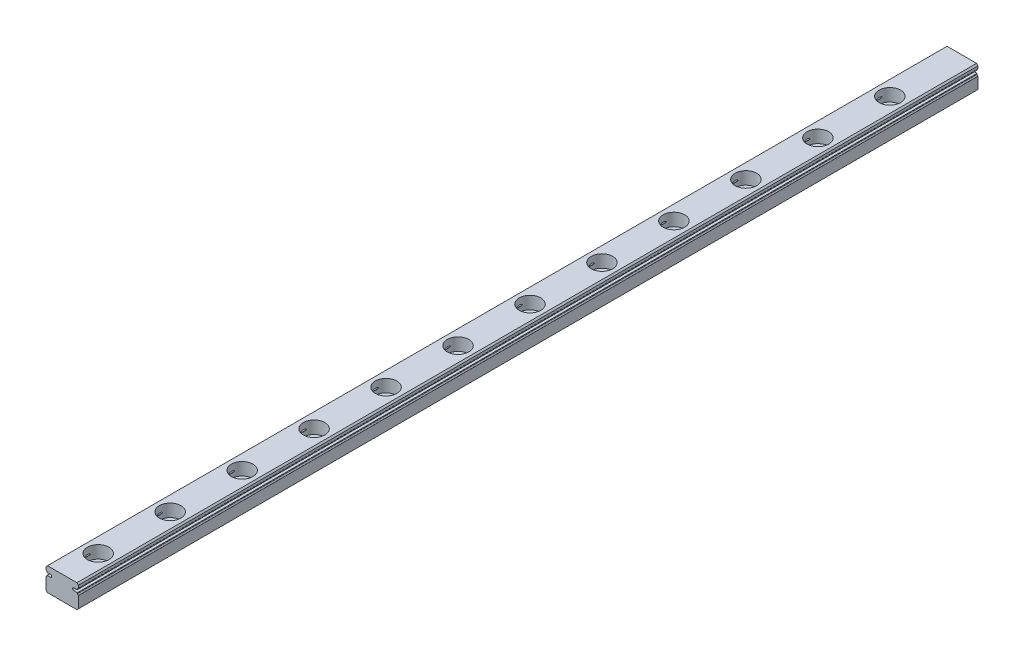
from build123d import *
from OCP.BRepFilletAPI import BRepFilletAPI_MakeChamfer

# Parameters (mm, degrees)
CROQUIS1_W                                           = 9
CROQUIS1_H                                           = 500
SALIENTE_EXTRUIR1_DEPTH                              = 6.5
CORTAR_EXTRUIR1_DEPTH                                = 501.031176557
CORTAR_EXTRUIR2_DEPTH                                = 501.031176557
CORTAR_EXTRUIR3_DEPTH                                = 501.031176557
CORTAR_EXTRUIR4_DEPTH                                = 501.031176557
CORTAR_EXTRUIR5_DEPTH                                = 501.031176557
CORTAR_EXTRUIR6_DEPTH                                = 501.031176557
CORTAR_EXTRUIR7_DEPTH                                = 501.031176557
REFRENTADO_PARA_TORNILLO_CON_CABEZA_HEXA_D           = 3.5
REFRENTADO_PARA_TORNILLO_CON_CABEZA_HEXA_CBORE_D     = 6
REFRENTADO_PARA_TORNILLO_CON_CABEZA_HEXA_CBORE_DEPTH = 3.5
CHAFL_N1_SIZE                                        = 0.4
CHAFL_N2_SIZE                                        = 0.01099309
CHAFL_N2_SIZE2                                       = 0.011992462
CHAFL_N3_SIZE                                        = 0.127904947
CHAFL_N3_SIZE_2                                      = 0.150967803
CROQUIS11_W                                          = 26.657955464
CROQUIS11_H                                          = 28.444613576
CORTAR_EXTRUIR8_DEPTH                                = 250


with BuildPart() as part:
    # Croquis1 → Saliente-Extruir1 (new body)
    with BuildSketch(Plane(origin=(0, 3.305681333, 0), x_dir=(1, 0, 0), z_dir=(0, 1, 0))):
        Rectangle(CROQUIS1_W, CROQUIS1_H)
    extrude(amount=-SALIENTE_EXTRUIR1_DEPTH)

    # Croquis2 → Cortar-Extruir1 (cut, through all)
    with BuildSketch(Plane(origin=(0, 0, -250), x_dir=(-1, 0, 0), z_dir=(0, 0, -1))):
        with BuildLine():
            Line((1.6, -3.194318667), (2.1, -3.194318667))
            ThreePointArc((2.1, -3.194318667), (1.85, -3.094318667), (1.6, -3.194318667))
        make_face()
    extrude(amount=-CORTAR_EXTRUIR1_DEPTH, mode=Mode.SUBTRACT)

    # Croquis3 → Cortar-Extruir2 (cut, through all)
    with BuildSketch(Plane(origin=(0, 0, -250), x_dir=(-1, 0, 0), z_dir=(0, 0, -1))):
        with BuildLine():
            Line((-4.5, 1.645681333), (-4.5, 0.945681333))
            Line((-4.5, 0.945681333), (-3.25, 0.945681333))
            ThreePointArc((-3.25, 0.945681333), (-2.9, 1.295681333), (-3.25, 1.645681333))
            Line((-3.25, 1.645681333), (-4.5, 1.645681333))
        make_face()
    extrude(amount=-CORTAR_EXTRUIR2_DEPTH, mode=Mode.SUBTRACT)

    # Croquis4 → Cortar-Extruir3 (cut, through all)
    with BuildSketch(Plane(origin=(0, 0, -250), x_dir=(-1, 0, 0), z_dir=(0, 0, -1))):
        with BuildLine():
            Line((-4.335296409, 0.945681333), (-4.5, 0.945681333))
            Line((-4.5, 0.945681333), (-4.5, 0.416920311))
            ThreePointArc((-4.5, 0.416920311), (-4.287857678, 0.640872415), (-4.335296409, 0.945681333))
        make_face()
    extrude(amount=-CORTAR_EXTRUIR3_DEPTH, mode=Mode.SUBTRACT)

    # Croquis5 → Cortar-Extruir4 (cut, through all)
    with BuildSketch(Plane(origin=(0, 0, -250), x_dir=(-1, 0, 0), z_dir=(0, 0, -1))):
        with BuildLine():
            Line((-4.5, 2.174442354), (-4.5, 1.645681333))
            Line((-4.5, 1.645681333), (-4.335296409, 1.645681333))
            ThreePointArc((-4.335296409, 1.645681333), (-4.287857678, 1.950490251), (-4.5, 2.174442354))
        make_face()
    extrude(amount=-CORTAR_EXTRUIR4_DEPTH, mode=Mode.SUBTRACT)

    # Croquis6 → Cortar-Extruir5 (cut, through all)
    with BuildSketch(Plane(origin=(0, 0, -250), x_dir=(-1, 0, 0), z_dir=(0, 0, -1))):
        with BuildLine():
            Line((4.5, 0.945681333), (4.5, 1.645681333))
            Line((4.5, 1.645681333), (3.25, 1.645681333))
            ThreePointArc((3.25, 1.645681333), (2.9, 1.295681333), (3.25, 0.945681333))
            Line((3.25, 0.945681333), (4.5, 0.945681333))
        make_face()
    extrude(amount=-CORTAR_EXTRUIR5_DEPTH, mode=Mode.SUBTRACT)

    # Croquis7 → Cortar-Extruir6 (cut, through all)
    with BuildSketch(Plane(origin=(0, 0, -250), x_dir=(-1, 0, 0), z_dir=(0, 0, -1))):
        with BuildLine():
            Line((4.335296409, 1.645681333), (4.5, 1.645681333))
            Line((4.5, 1.645681333), (4.5, 2.174442354))
            ThreePointArc((4.5, 2.174442354), (4.287857678, 1.950490251), (4.335296409, 1.645681333))
        make_face()
    extrude(amount=-CORTAR_EXTRUIR6_DEPTH, mode=Mode.SUBTRACT)

    # Croquis8 → Cortar-Extruir7 (cut, through all)
    with BuildSketch(Plane(origin=(0, 0, -250), x_dir=(-1, 0, 0), z_dir=(0, 0, -1))):
        with BuildLine():
            Line((4.5, 0.416920311), (4.5, 0.945681333))
            Line((4.5, 0.945681333), (4.335296409, 0.945681333))
            ThreePointArc((4.335296409, 0.945681333), (4.287857678, 0.640872415), (4.5, 0.416920311))
        make_face()
    extrude(amount=-CORTAR_EXTRUIR7_DEPTH, mode=Mode.SUBTRACT)

    # Refrentado para tornillo con cabeza hexagonal de M31 (through all)
    with Locations(Plane(origin=(0, 3.305681333, 0), x_dir=(1, 0, 0), z_dir=(0, 1, 0))):
        with Locations((0, -240), (0, -220), (0, -200), (0, -180), (0, -160), (0, -140), (0, -120), (0, -100), (0, -80), (0, -60), (0, -40), (0, -20)):
            CounterBoreHole(REFRENTADO_PARA_TORNILLO_CON_CABEZA_HEXA_D / 2, REFRENTADO_PARA_TORNILLO_CON_CABEZA_HEXA_CBORE_D / 2, REFRENTADO_PARA_TORNILLO_CON_CABEZA_HEXA_CBORE_DEPTH)

    # Chaflán1
    chafl_n1_edges = [part.edges().sort_by_distance(p)[0] for p in [
        (-4.5, -3.194318667, 0),
        (4.5, -3.194318667, 0),
        (-4.5, 3.305681333, 0),
        (4.5, 3.305681333, 0),
    ]]
    chamfer(chafl_n1_edges, length=CHAFL_N1_SIZE)

    # Chaflán2: one chamfer whose edges measure the first distance from different faces: ONE call of the kernel's chamfer builder (chamfer() names one face for all edges)
    chafl_n2_edges_1 = [part.edges().sort_by_distance(p)[0] for p in [
        (4.5, 0.416920311, 0),
    ]]
    chafl_n2_side_1 = [part.faces().sort_by_distance(p)[0] for p in [
        (4.287857678, 0.640872415, 0),
    ]]
    chafl_n2_edges_2 = [part.edges().sort_by_distance(p)[0] for p in [
        (4.5, 2.174442354, 0),
    ]]
    chafl_n2_side_2 = [part.faces().sort_by_distance(p)[0] for p in [
        (4.5, 2.540061844, 0),
    ]]
    chafl_n2_edges_3 = [part.edges().sort_by_distance(p)[0] for p in [
        (-4.5, 2.174442354, 0),
    ]]
    chafl_n2_side_3 = [part.faces().sort_by_distance(p)[0] for p in [
        (-4.5, 2.540061844, 0),
    ]]
    chafl_n2_edges_4 = [part.edges().sort_by_distance(p)[0] for p in [
        (-4.5, 0.416920311, 0),
    ]]
    chafl_n2_side_4 = [part.faces().sort_by_distance(p)[0] for p in [
        (-4.287857678, 0.640872415, 0),
    ]]
    chafl_n2 = BRepFilletAPI_MakeChamfer(part.part.solid().wrapped)
    for e in chafl_n2_edges_1:
        chafl_n2.Add(CHAFL_N2_SIZE, CHAFL_N2_SIZE2, e.wrapped, chafl_n2_side_1[0].wrapped)  # the first distance lies on this face
    for e in chafl_n2_edges_2:
        chafl_n2.Add(CHAFL_N2_SIZE, CHAFL_N2_SIZE2, e.wrapped, chafl_n2_side_2[0].wrapped)  # the first distance lies on this face
    for e in chafl_n2_edges_3:
        chafl_n2.Add(CHAFL_N2_SIZE, CHAFL_N2_SIZE2, e.wrapped, chafl_n2_side_3[0].wrapped)  # the first distance lies on this face
    for e in chafl_n2_edges_4:
        chafl_n2.Add(CHAFL_N2_SIZE, CHAFL_N2_SIZE2, e.wrapped, chafl_n2_side_4[0].wrapped)  # the first distance lies on this face
    add(Compound.cast(chafl_n2.Shape()), mode=Mode.REPLACE)

    # Chaflán3
    # the kernel refuses this chamfer: 0.150967803, 0.127904947 mm, written as the material it takes off along each edge
    with BuildSketch(Plane(origin=(4.335296409, 0.945681333, -250.52140873), x_dir=(-1, 0, 0), z_dir=(0, 0, 1))) as chafl_n3_piece_1:
        with BuildLine():
            Line((CHAFL_N3_SIZE * 0.999999997415, 0), (0.063202886, 0.193627514))
            ThreePointArc((0.063202886, 0.193627514), (0.046780091, 0.094540285), (0, 0))
            Line((0, 0), (CHAFL_N3_SIZE * 0.999999997415, 0))
        make_face()
    extrude(amount=501.04281746, mode=Mode.SUBTRACT)
    with BuildSketch(Plane(origin=(4.335296409, 1.645681333, -250.386595906), x_dir=(-0.39790739752013976, 0.9174255844474523, 0), z_dir=(0, 0, 1))) as chafl_n3_piece_2:
        with BuildLine():
            Line((0.140111683, 0), (CHAFL_N3_SIZE_2 * 0.397907396617, CHAFL_N3_SIZE_2 * 0.917425582366))
            Line((CHAFL_N3_SIZE_2 * 0.397907396617, CHAFL_N3_SIZE_2 * 0.917425582366), (0, 0))
            ThreePointArc((0, 0), (0.071609636, 0.00707939), (0.140111683, 0))
        make_face()
    extrude(amount=500.773191813, mode=Mode.SUBTRACT)
    with BuildSketch(Plane(origin=(-4.335296409, 1.645681333, -250.52140873), x_dir=(0.3103022888966752, 0.950637938179139, 0), z_dir=(0, 0, 1))) as chafl_n3_piece_3:
        with BuildLine():
            Line((0.203681661, 0), (CHAFL_N3_SIZE * 0.310302288095, -CHAFL_N3_SIZE * 0.950637935722))
            Line((CHAFL_N3_SIZE * 0.310302288095, -CHAFL_N3_SIZE * 0.950637935722), (0, 0))
            ThreePointArc((0, 0), (0.104389551, -0.015134863), (0.203681661, 0))
        make_face()
    extrude(amount=501.04281746, mode=Mode.SUBTRACT)
    with BuildSketch(Plane(origin=(-4.335296409, 0.945681333, -250.386595906), x_dir=(1, 0, 0), z_dir=(0, 0, 1))) as chafl_n3_piece_4:
        with BuildLine():
            Line((CHAFL_N3_SIZE_2 * 0.999999997731, 0), (0.055751475, -0.128542042))
            ThreePointArc((0.055751475, -0.128542042), (0.034988818, -0.06287957), (0, 0))
            Line((0, 0), (CHAFL_N3_SIZE_2 * 0.999999997731, 0))
        make_face()
    extrude(amount=500.773191813, mode=Mode.SUBTRACT)

    # Croquis11 → Cortar-Extruir8 (cut)
    with BuildSketch(Plane(origin=(0, 0, -250), x_dir=(-1, 0, 0), z_dir=(0, 0, -1))):
        with Locations((0.879808547, -2.192815701)):
            Rectangle(CROQUIS11_W, CROQUIS11_H)
    extrude(amount=-CORTAR_EXTRUIR8_DEPTH, mode=Mode.SUBTRACT)


solid = part.part
